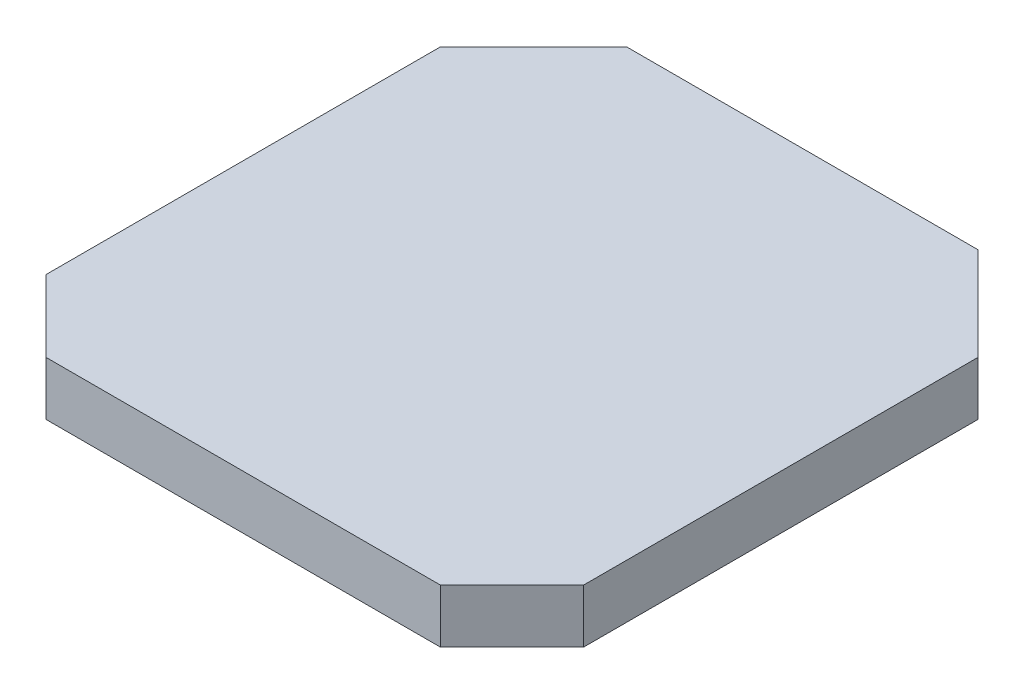
from build123d import *

# Parameters (mm, degrees)
BOSS_EXTRUDE1_DEPTH = 7.5
BOSS_EXTRUDE4_DEPTH = 3
CHAMFER7_SIZE       = 3
CHAMFER8_SIZE       = 3


with BuildPart() as part:
    # Sketch1 → Boss-Extrude1 (new body)
    with BuildSketch(Plane(origin=(0, 0, 0), x_dir=(1, 0, 0), z_dir=(0, 1, 0))):
        Polygon((-37.5, 27.5), (-27.5, 37.5), (27.5, 37.5), (37.5, 27.5), (37.5, -27.5), (27.5, -37.5), (-27.5, -37.5), (-37.5, -27.5), align=None)
    extrude(amount=BOSS_EXTRUDE1_DEPTH)

    # Sketch8 → Boss-Extrude4 (add)
    with BuildSketch(Plane(origin=(0, 0, -37.5), x_dir=(-1, 0, 0), z_dir=(0, 0, -1))):
        Polygon((-25, 3), (25, 3), (27.5, 3), (27.5, 7.5), (25, 7.5), (-25, 7.5), (-27.5, 7.5), (-27.5, 3), align=None)
    extrude(amount=BOSS_EXTRUDE4_DEPTH)

    # Chamfer7
    chamfer7_edges = [part.edges().sort_by_distance(p)[0] for p in [
        (0, 3, -40.5),
    ]]
    chamfer(chamfer7_edges, length=CHAMFER7_SIZE - 0.0001)  # a hair under: the kernel refuses the full size

    # Chamfer8
    chamfer8_edges = [part.edges().sort_by_distance(p)[0] for p in [
        (-27.5, 6.74995, -40.5),
        (27.5, 6.74995, -40.5),
    ]]
    chamfer(chamfer8_edges, length=CHAMFER8_SIZE - 0.0001)  # a hair under: the kernel refuses the full size


solid = part.part
